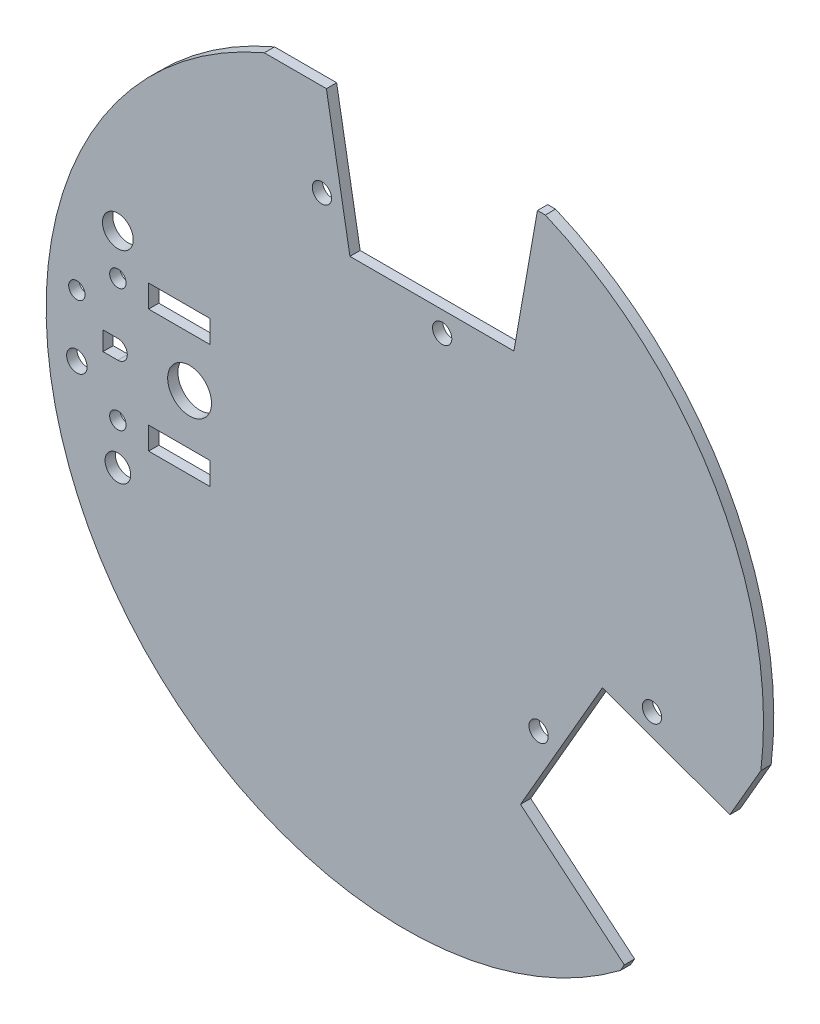
from build123d import *

# Parameters (mm, degrees)
ESQUISSE1_R             = 175
BOSS_EXTRU_1_DEPTH      = 5
ESQUISSE2_R             = 4.7
ENL_V_MAT_EXTRU_1_DEPTH = 5
LEDS_BOUT_TIRETTE_R     = 10.7
LEDS_BOUT_TIRETTE_R_2   = 6.25
LEDS_BOUT_TIRETTE_R_3   = 4
LEDS_BOUT_TIRETTE_R_4   = 5
LEDS_BOUT_TIRETTE_R_5   = 7.5
LEDS_BOUT_TIRETTE_W     = 30
LEDS_BOUT_TIRETTE_H     = 11
LEDS_BUTTONS_DEPTH      = 10


with BuildPart() as part:
    # Esquisse1 → Boss.-Extru.1 (new body)
    with BuildSketch(Plane.XY):
        Circle(ESQUISSE1_R)
    extrude(amount=BOSS_EXTRU_1_DEPTH)

    # Esquisse2 → Enlèv. mat.-Extru.1 (cut)
    with BuildSketch(Plane(origin=(0, 0, 0), x_dir=(-1, 0, 0), z_dir=(0, 0, -1))):
        with Locations((-18.220426897, 85.887612711)):
            Circle(ESQUISSE2_R)
        with Locations((40.460378836, 115.887612711)):
            Circle(ESQUISSE2_R)
        with Locations((-65.270641029, -58.723158916)):
            Circle(ESQUISSE2_R)
        with Locations((-120.59180601, -22.904090436)):
            Circle(ESQUISSE2_R)
        Polygon((26.7795731, 95.88761271), (38.263317053, 161.015161015), (68.550112498, 161.015161015), (68.550112498, 190.246123658), (-94.990966298, 190.246123658), (-94.990966298, 161.015161015), (-64.704170853, 161.015161015), (-53.2204269, 95.88761271), align=None)
        Polygon((-96.430895065, -24.752015748), (-158.57487836, -47.370575906), (-173.718276082, -21.141441652), (-199.033032308, -35.756922974), (-117.262492911, -177.387651773), (-91.947736684, -162.772170451), (-107.091134406, -136.543036197), (-56.430895065, -94.034048051), align=None)
    extrude(amount=-ENL_V_MAT_EXTRU_1_DEPTH, mode=Mode.SUBTRACT)

    # Leds, bout., tirette → Leds, buttons (cut)
    with BuildSketch(Plane.XY.offset(5)):
        with Locations((-105, 0)):
            Circle(LEDS_BOUT_TIRETTE_R)
        with Locations((-140, -50)):
            Circle(LEDS_BOUT_TIRETTE_R_2)
        with Locations((-140, 30)):
            Circle(LEDS_BOUT_TIRETTE_R_3)
        with Locations((-140, -30)):
            Circle(LEDS_BOUT_TIRETTE_R_3)
        with Locations((-160, 15)):
            Circle(LEDS_BOUT_TIRETTE_R_3)
        with Locations((-160, -15)):
            Circle(LEDS_BOUT_TIRETTE_R_4)
        with Locations((-140, 50)):
            Circle(LEDS_BOUT_TIRETTE_R_5)
        with BuildLine():
            Line((-140, -4.6), (-147.25, -4.6))
            Line((-147.25, -4.6), (-147.25, 4.6))
            Line((-147.25, 4.6), (-140, 4.6))
            ThreePointArc((-140, 4.6), (-135.4, 0), (-140, -4.6))
        make_face()
        with Locations((-110, 30)):
            Rectangle(LEDS_BOUT_TIRETTE_W, LEDS_BOUT_TIRETTE_H)
        with Locations((-110, -30)):
            Rectangle(LEDS_BOUT_TIRETTE_W, LEDS_BOUT_TIRETTE_H)
    extrude(amount=-LEDS_BUTTONS_DEPTH, mode=Mode.SUBTRACT)


solid = part.part
